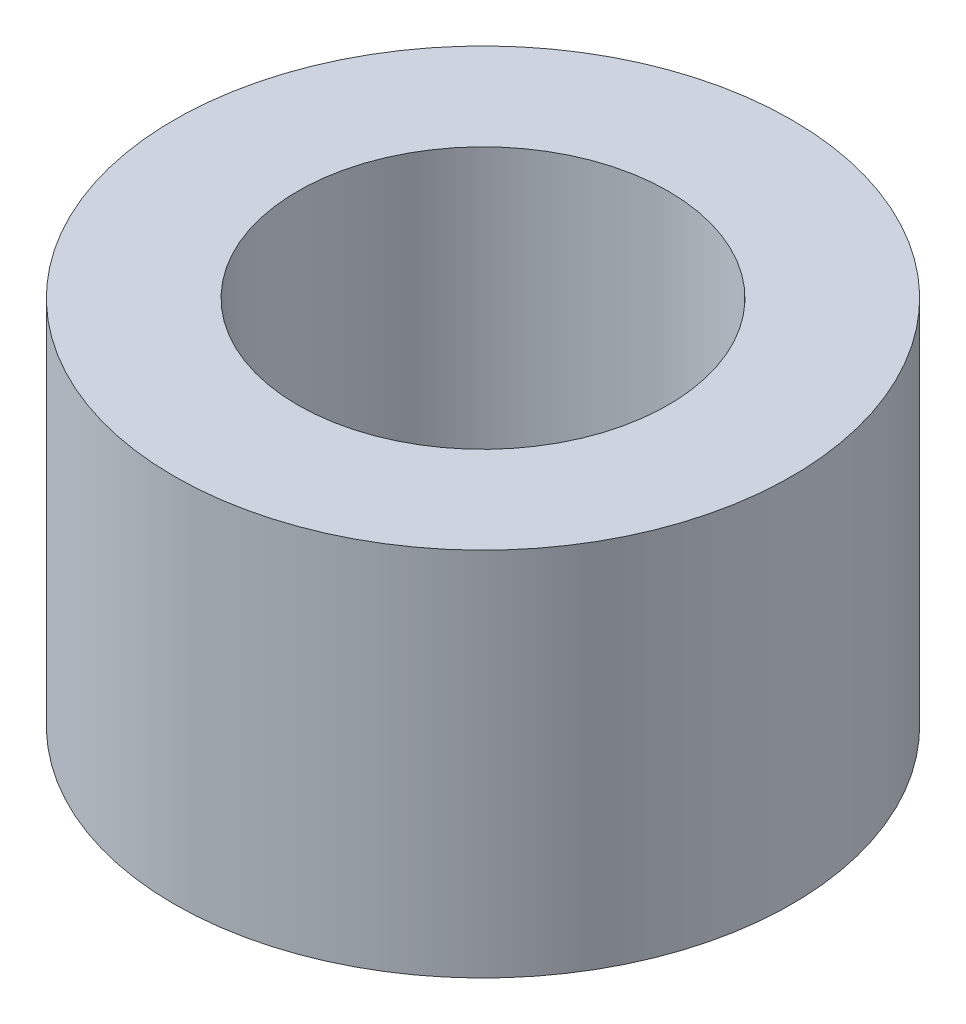
from build123d import *

# Parameters (mm, degrees)
SKETCH1_R           = 2.5
BOSS_EXTRUDE1_DEPTH = 3
SKETCH2_R           = 1.5
CUT_EXTRUDE1_DEPTH  = 5.636809248


with BuildPart() as part:
    # Sketch1 → Boss-Extrude1 (new body)
    with BuildSketch(Plane(origin=(0, 0, 0), x_dir=(1, 0, 0), z_dir=(0, 1, 0))):
        Circle(SKETCH1_R)
    extrude(amount=BOSS_EXTRUDE1_DEPTH)

    # Sketch2 → Cut-Extrude1 (cut, through all)
    with BuildSketch(Plane(origin=(0, 3, 0), x_dir=(1, 0, 0), z_dir=(0, 1, 0))):
        Circle(SKETCH2_R)
    extrude(amount=-CUT_EXTRUDE1_DEPTH, mode=Mode.SUBTRACT)


solid = part.part
